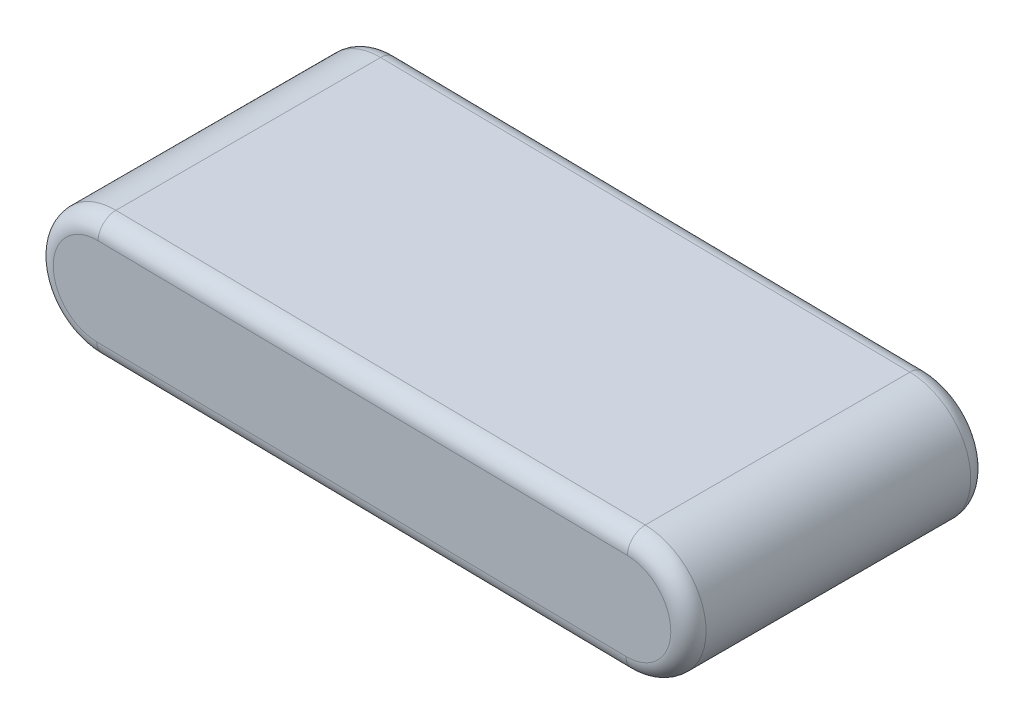
from build123d import *

# Parameters (mm, degrees)
RESSALTO_EXTRUS_O1_DEPTH = 17
FILETE1_R                = 1


with BuildPart() as part:
    # Esboço1 → Ressalto-extrusão1 (new body)
    with BuildSketch(Plane.XY):
        with BuildLine():
            Line((-14.947871578, 3.723044087), (15.052128422, 3.276179478))
            ThreePointArc((15.052128422, 3.276179478), (18.499611782, -0.275560726), (14.947871578, -3.723044087))
            Line((14.947871578, -3.723044087), (-15.052128422, -3.276179478))
            ThreePointArc((-15.052128422, -3.276179478), (-18.499611782, 0.275560726), (-14.947871578, 3.723044087))
        make_face()
    extrude(amount=RESSALTO_EXTRUS_O1_DEPTH)

    # Filete1
    filete1_edges = [part.edges().sort_by_distance(p)[0] for p in [
        (18.499611782, -0.275560726, 0),
        (-0.052128422, -3.499611782, 0),
        (-18.499611782, 0.275560726, 0),
        (18.499611782, -0.275560726, 17),
        (-0.052128422, -3.499611782, 17),
        (-18.499611782, 0.275560726, 17),
        (0.052128422, 3.499611782, 0),
        (0.052128422, 3.499611782, 17),
    ]]
    fillet(filete1_edges, radius=FILETE1_R)


solid = part.part
